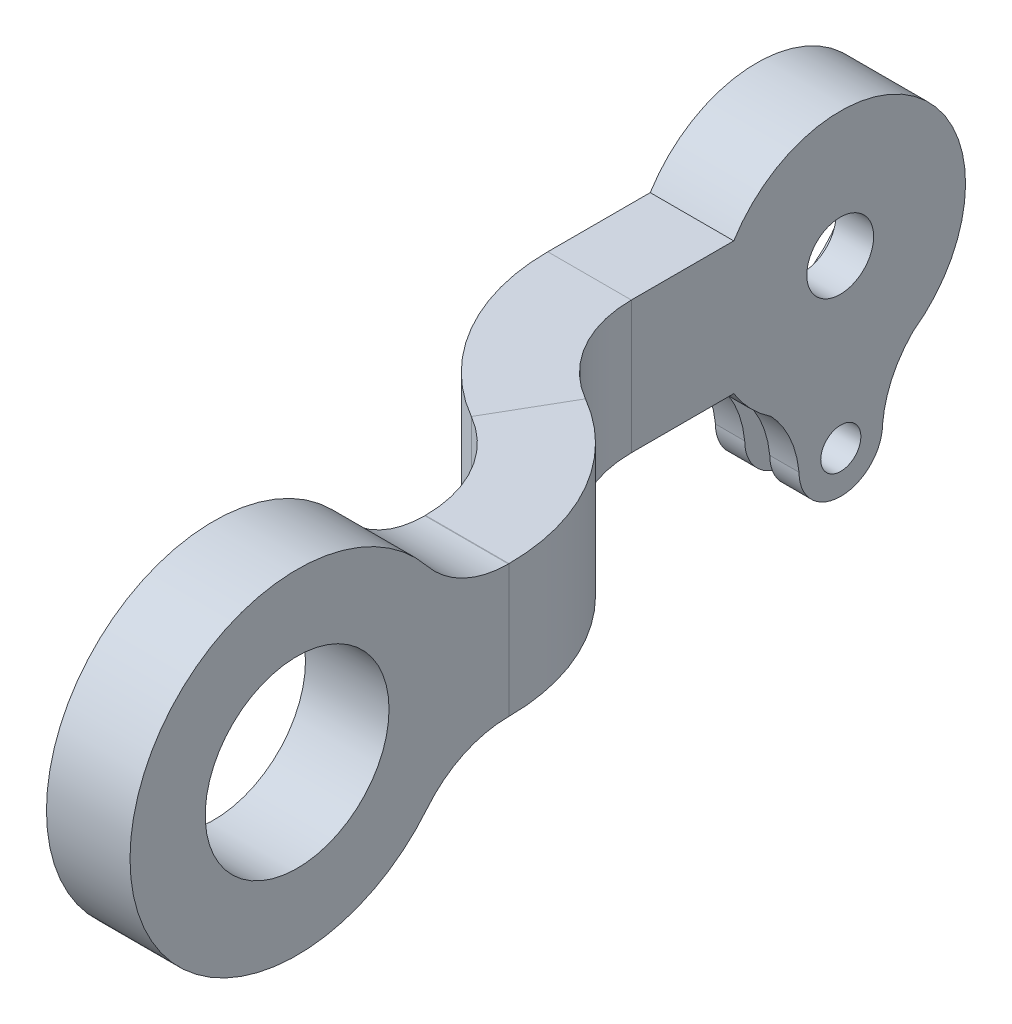
from build123d import *

# Parameters (mm, degrees)
CROQUIS2_W              = 10
CROQUIS2_H              = 15.834903248
CROQUIS4_R              = 15
SALIENTE_EXTRUIR1_DEPTH = 10
CROQUIS5_R              = 20
SALIENTE_EXTRUIR2_DEPTH = 10
SALIENTE_EXTRUIR5_DEPTH = 3.5
CROQUIS13_R             = 2.5
CORTAR_EXTRUIR1_DEPTH   = 10
SIMETR_A3_COPY_1_DEPTH  = 3.5
SIMETR_A3_COPY_2_DEPTH  = 3.5
CORTAR_EXTRUIR5_DEPTH   = 10
CROQUIS21_R             = 2.4
CORTAR_EXTRUIR6_DEPTH   = 10
CROQUIS7_R              = 11
CORTAR_EXTRUIR7_DEPTH   = 10
REDONDEO1_R             = 12.5
REDONDEO2_R             = 12.5
CROQUIS22_R             = 11.5
CORTAR_EXTRUIR8_DEPTH   = 5.5
CROQUIS6_R              = 4
CORTAR_EXTRUIR9_DEPTH   = 5.5


with BuildPart() as part:
    # Barrer1: sweep along a path in Croquis1
    with BuildLine(Plane(origin=(0, 0, 0), x_dir=(1, 0, 0), z_dir=(0, 1, 0))) as barrer1_path:
        Line((-20, 85), (-20, 60))
        ThreePointArc((-20, 60), (-17.320508076, 50), (-10, 42.679491924))
        ThreePointArc((-10, 42.679491924), (-2.679491924, 35.358983849), (0, 25.358983849))
        Line((0, 25.358983849), (0, 0))
    # Croquis2 → Barrer1 (sweep)
    with BuildSketch(Plane.XY):
        Rectangle(CROQUIS2_W, CROQUIS2_H)
    sweep(path=barrer1_path.line)

    # Croquis4 → Saliente-Extruir1 (add)
    with BuildSketch(Plane(origin=(-15, 0, 0), x_dir=(0, 0, -1), z_dir=(1, 0, 0))):
        with Locations((85, 0)):
            Circle(CROQUIS4_R)
    extrude(amount=-SALIENTE_EXTRUIR1_DEPTH)

    # Croquis5 → Saliente-Extruir2 (add)
    with BuildSketch(Plane(origin=(5, 0, 0), x_dir=(0, 0, -1), z_dir=(1, 0, 0))):
        Circle(CROQUIS5_R)
    extrude(amount=-SALIENTE_EXTRUIR2_DEPTH)

    # Croquis12 → Saliente-Extruir5 (add)
    with BuildSketch(Plane(origin=(-15, 0, 0), x_dir=(0, 0, -1), z_dir=(1, 0, 0))):
        with BuildLine():
            ThreePointArc((90.068496439, 19.972615481), (85.068496439, 24.972615481), (80.068496439, 19.972615481))
            add(Edge.make_bspline(
                [(80.068496439, 19.972615481), (79.566731031, 15.028252388), (75.848465439, 11.643922813)],
                knots=[0, 0, 0, 1, 1, 1], degree=2))
            ThreePointArc((75.848465439, 11.643922813), (85.068496439, 14.846363713), (94.288527439, 11.643922813))
            add(Edge.make_bspline(
                [(90.068496439, 19.972615481), (90.570261847, 15.028252388), (94.288527439, 11.643922813)],
                knots=[0, 0, 0, 1, 1, 1], degree=2))
        make_face()
    saliente_extruir5 = extrude(amount=-SALIENTE_EXTRUIR5_DEPTH)

    # Simetría1: Saliente-Extruir5 across plane
    add(saliente_extruir5.mirror(Plane(origin=(-20, 0, 0), x_dir=(0, 0, 1), z_dir=(1, 0, 0))))

    # Croquis13 → Cortar-Extruir1 (cut)
    with BuildSketch(Plane(origin=(-15, 0, 0), x_dir=(0, 0, -1), z_dir=(1, 0, 0))):
        with Locations((85.068496439, 19.972615481)):
            Circle(CROQUIS13_R)
    extrude(amount=-CORTAR_EXTRUIR1_DEPTH, mode=Mode.SUBTRACT)

    # Simetría3 copy 1 sketch → Simetría3 copy 1 (add)
    with BuildSketch(Plane(origin=(-25, 0, 0), x_dir=(0, 0, -1), z_dir=(-1, 0, 0))):
        with BuildLine():
            ThreePointArc((90.068496439, 19.972615481), (85.068496439, 24.972615481), (80.068496439, 19.972615481))
            add(Edge.make_bspline(
                [(80.068496439, 19.972615481), (79.566731031, 15.028252388), (75.848465439, 11.643922813)],
                knots=[0, 0, 0, 1, 1, 1], degree=2))
            ThreePointArc((75.848465439, 11.643922813), (85.068496439, 14.846363713), (94.288527439, 11.643922813))
            add(Edge.make_bspline(
                [(90.068496439, 19.972615481), (90.570261847, 15.028252388), (94.288527439, 11.643922813)],
                knots=[0, 0, 0, 1, 1, 1], degree=2))
        make_face()
    extrude(amount=-SIMETR_A3_COPY_1_DEPTH)

    # Simetría3 copy 2 sketch → Simetría3 copy 2 (add)
    with BuildSketch(Plane(origin=(-15, 0, 0), x_dir=(0, 0, -1), z_dir=(1, 0, 0))):
        with BuildLine():
            ThreePointArc((90.068496439, -19.972615481), (85.068496439, -24.972615481), (80.068496439, -19.972615481))
            add(Edge.make_bspline(
                [(80.068496439, -19.972615481), (79.566731031, -15.028252388), (75.848465439, -11.643922813)],
                knots=[0, 0, 0, 1, 1, 1], degree=2))
            ThreePointArc((75.848465439, -11.643922813), (85.068496439, -14.846363713), (94.288527439, -11.643922813))
            add(Edge.make_bspline(
                [(90.068496439, -19.972615481), (90.570261847, -15.028252388), (94.288527439, -11.643922813)],
                knots=[0, 0, 0, 1, 1, 1], degree=2))
        make_face()
    extrude(amount=-SIMETR_A3_COPY_2_DEPTH)

    # Croquis20 → Cortar-Extruir5 (cut)
    with BuildSketch(Plane(origin=(-15, 0, 0), x_dir=(0, 0, -1), z_dir=(1, 0, 0))):
        with BuildLine():
            Line((75.916830569, 25.735778906), (95.172377376, 25.735778906))
            Line((95.172377376, 25.735778906), (95.172377376, 11.023735234))
            ThreePointArc((95.172377376, 11.023735234), (85.710763224, 14.983151058), (75.916830569, 11.93717023))
            Line((75.916830569, 11.93717023), (75.916830569, 25.735778906))
        make_face()
    extrude(amount=-CORTAR_EXTRUIR5_DEPTH, mode=Mode.SUBTRACT)

    # Croquis21 → Cortar-Extruir6 (cut)
    with BuildSketch(Plane.ZY.offset(25)):
        with Locations((-85.068496439, -19.972615481)):
            Circle(CROQUIS21_R)
    extrude(amount=-CORTAR_EXTRUIR6_DEPTH, mode=Mode.SUBTRACT)

    # Croquis7 → Cortar-Extruir7 (cut)
    with BuildSketch(Plane(origin=(5, 0, 0), x_dir=(0, 0, -1), z_dir=(1, 0, 0))):
        Circle(CROQUIS7_R)
    extrude(amount=-CORTAR_EXTRUIR7_DEPTH, mode=Mode.SUBTRACT)

    # Redondeo1
    redondeo1_edges = [part.edges().sort_by_distance(p)[0] for p in [
        (0, -7.917451624, -18.366108999),
    ]]
    fillet(redondeo1_edges, radius=REDONDEO1_R)

    # Redondeo2
    redondeo2_edges = [part.edges().sort_by_distance(p)[0] for p in [
        (0, 7.917451624, -18.366108999),
    ]]
    fillet(redondeo2_edges, radius=REDONDEO2_R)

    # Croquis22 → Cortar-Extruir8 (cut)
    with BuildSketch(Plane.ZY.offset(25)):
        with Locations((-85, 0)):
            Circle(CROQUIS22_R)
    extrude(amount=-CORTAR_EXTRUIR8_DEPTH, mode=Mode.SUBTRACT)

    # Croquis6 → Cortar-Extruir9 (cut)
    with BuildSketch(Plane(origin=(-15, 0, 0), x_dir=(0, 0, -1), z_dir=(1, 0, 0))):
        with Locations((85, 0)):
            Circle(CROQUIS6_R)
    extrude(amount=-CORTAR_EXTRUIR9_DEPTH, mode=Mode.SUBTRACT)


solid = part.part
